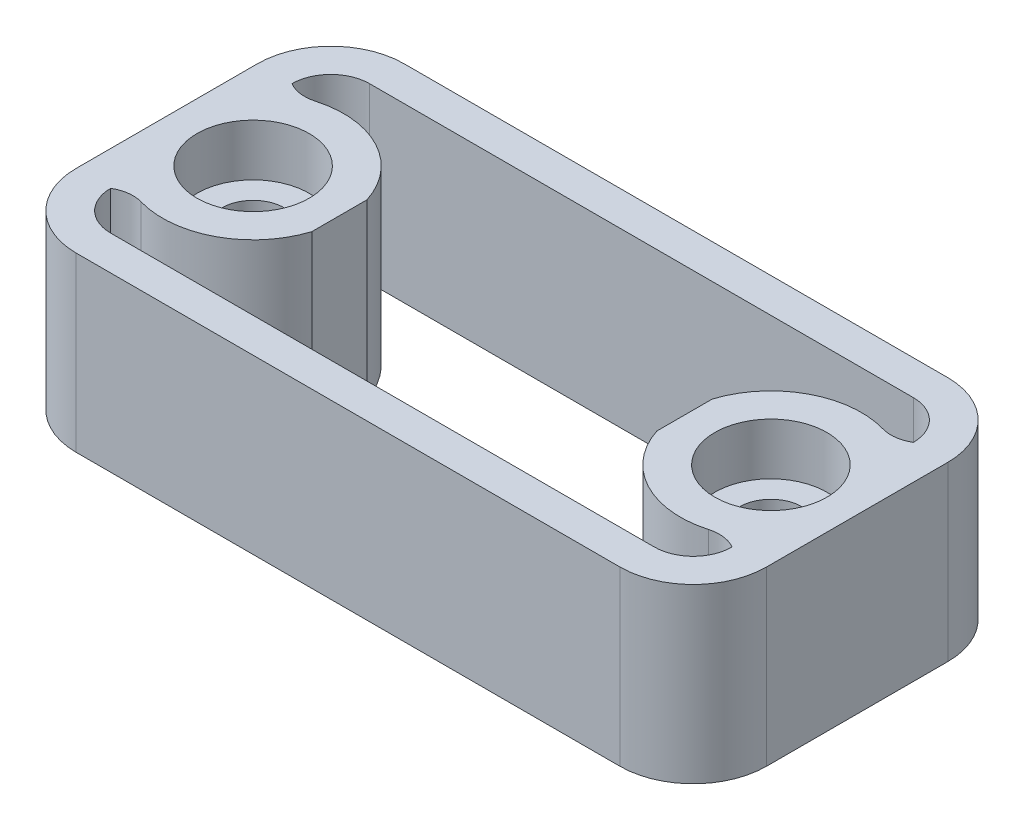
from build123d import *

# Parameters (mm, degrees)
SKETCH1_W                      = 40
SKETCH1_H                      = 19
SKETCH1_W_2                    = 36
SKETCH1_H_2                    = 15
BOSS_EXTRUDE1_DEPTH            = 10
FILLET1_R                      = 4.25
BOSS_EXTRUDE2_START            = 10
BOSS_EXTRUDE2_DEPTH            = 10
CBORE_FOR_M3_SHCS1_D           = 3.6
CBORE_FOR_M3_SHCS1_CBORE_D     = 6.5
CBORE_FOR_M3_SHCS1_CBORE_DEPTH = 3
CUT_EXTRUDE1_DEPTH             = 25.295061227
FILLET2_R                      = 2


with BuildPart() as part:
    # Sketch1 → Boss-Extrude1 (new body)
    with BuildSketch(Plane(origin=(0, 0, 0), x_dir=(1, 0, 0), z_dir=(0, 1, 0))):
        Rectangle(SKETCH1_W, SKETCH1_H)
        Rectangle(SKETCH1_W_2, SKETCH1_H_2, mode=Mode.SUBTRACT)
    extrude(amount=BOSS_EXTRUDE1_DEPTH)

    # Fillet1
    fillet1_edges = [part.edges().sort_by_distance(p)[0] for p in [
        (-18, 5, -7.5),
        (-18, 5, 7.5),
        (18, 5, 7.5),
        (18, 5, -7.5),
        (20, 5, 9.5),
        (-20, 5, 9.5),
        (-20, 5, -9.5),
        (20, 5, -9.5),
    ]]
    fillet(fillet1_edges, radius=FILLET1_R)

    # Sketch2 → Boss-Extrude2 (add)
    with BuildSketch(Plane(origin=(0, 0, 0), x_dir=(1, 0, 0), z_dir=(0, 1, 0)).offset(BOSS_EXTRUDE2_START)):
        with BuildLine():
            Line((18, -3.25), (18, 3.25))
            ThreePointArc((18, 3.25), (16.75520382, 6.25520382), (13.75, 7.5))
            Line((13.75, 7.5), (10, 7.5))
            Line((10, 7.5), (10, -7.5))
            Line((10, -7.5), (13.75, -7.5))
            ThreePointArc((13.75, -7.5), (16.75520382, -6.25520382), (18, -3.25))
        make_face()
        with BuildLine():
            Line((-13.75, -7.5), (-10, -7.5))
            Line((-10, -7.5), (-10, 7.5))
            Line((-10, 7.5), (-13.75, 7.5))
            ThreePointArc((-13.75, 7.5), (-16.75520382, 6.25520382), (-18, 3.25))
            Line((-18, 3.25), (-18, -3.25))
            ThreePointArc((-18, -3.25), (-16.75520382, -6.25520382), (-13.75, -7.5))
        make_face()
    extrude(amount=-BOSS_EXTRUDE2_DEPTH)

    # CBORE for M3 SHCS1 (through all)
    with Locations(Plane(origin=(0, 10, 0), x_dir=(1, 0, 0), z_dir=(0, 1, 0))):
        with Locations((-15, 0), (15, 0)):
            CounterBoreHole(CBORE_FOR_M3_SHCS1_D / 2, CBORE_FOR_M3_SHCS1_CBORE_D / 2, CBORE_FOR_M3_SHCS1_CBORE_DEPTH)

    # Sketch5 → Cut-Extrude1 (cut, through all)
    with BuildSketch(Plane(origin=(0, 10, 0), x_dir=(1, 0, 0), z_dir=(0, 1, 0))):
        with BuildLine():
            Line((15.75, 7.5), (-15.75, 7.5))
            ThreePointArc((-15.75, 7.5), (-17.340990258, 6.840990258), (-18, 5.25))
            Line((-18, 5.25), (-18, 4.308421985))
            ThreePointArc((-18, 4.308421985), (-9.75, 0), (-18, -4.308421985))
            Line((-18, -4.308421985), (-18, -5.25))
            ThreePointArc((-18, -5.25), (-17.340990258, -6.840990258), (-15.75, -7.5))
            Line((-15.75, -7.5), (15.75, -7.5))
            ThreePointArc((15.75, -7.5), (17.340990258, -6.840990258), (18, -5.25))
            Line((18, -5.25), (18, -4.308421985))
            ThreePointArc((18, -4.308421985), (9.75, 0), (18, 4.308421985))
            Line((18, 4.308421985), (18, 5.25))
            ThreePointArc((18, 5.25), (17.340990258, 6.840990258), (15.75, 7.5))
        make_face()
    extrude(amount=-CUT_EXTRUDE1_DEPTH, mode=Mode.SUBTRACT)

    # Fillet2
    # the kernel refuses this fillet: 2 mm, written as the material it adds along each edge
    with BuildSketch(Plane(origin=(18, 10, 4.308421985), x_dir=(-0.9035715432909278, 0, 0.42843723712447174), z_dir=(0, -1, 0)), Plane(origin=(-18, 10, -4.308421985), x_dir=(0.9035715432909261, 0, -0.4284372371244754), z_dir=(0, -1, 0))) as fillet2_piece_1:
        with BuildLine():
            CenterArc((2.059110044, -1.972677796), FILLET2_R, 99.481480479, 46.397181027)
            Line((0.403407083, -0.8507831), (0.370293024, -0.828345206))
            ThreePointArc((0.370293024, -0.828345206), (0.16556068, -0.44252904), (-0.036142862, -0.017137489))
            Line((-0.036142862, -0.017137489), (0.006589152, 0.039453556))
            ThreePointArc((0.006589152, 0.039453556), (0.864826218, -0.031720787), (1.723063284, 0.039453556))
            Line((1.723063284, 0.039453556), (1.729652437, 0))
        make_face()
    extrude(amount=10)
    with BuildSketch(Plane(origin=(18, 10, -4.308421985), x_dir=(0, 0, -1), z_dir=(0, -1, 0)), Plane(origin=(-18, 10, 4.308421985), x_dir=(0, 0, 1), z_dir=(0, -1, 0))) as fillet2_piece_2:
        with BuildLine():
            CenterArc((2.664654938, -1.015384615), FILLET2_R, 149.489762594, 46.397181027)
            Line((0.741047511, -1.562864721), (0.702575363, -1.573814324))
            ThreePointArc((0.702575363, -1.573814324), (0.399185756, -0.767841995), (-0.032826072, -0.022857143))
            Line((-0.032826072, -0.022857143), (0, 0.04))
            ThreePointArc((0, 0.04), (0.470789008, 0.04), (0.907116477, 0.020307692))
            Line((0.907116477, 0.020307692), (0.941578015, 0))
        make_face()
    extrude(amount=10)


solid = part.part
